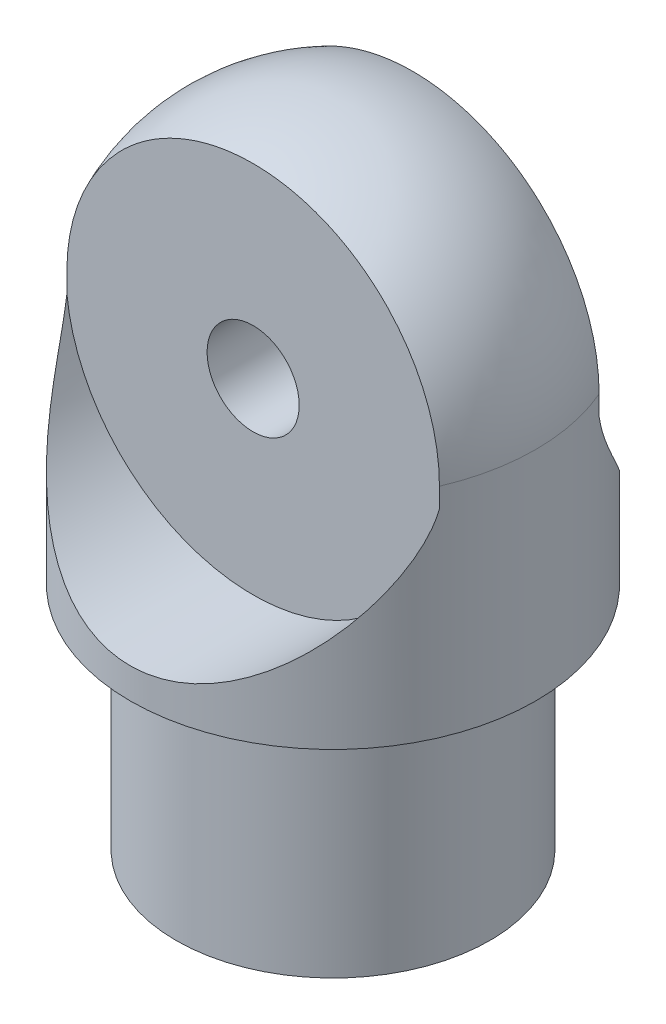
from build123d import *

# Parameters (mm, degrees)
SKETCH1_R               = 12.9794
BOSS_EXTRUDE1_DEPTH     = 19.05
CUT_EXTRUDE1_DEPTH      = 59.815433775
CUT_EXTRUDE1_DEPTH_BACK = 59.815433775
SKETCH4_R               = 3.81
SKETCH5_R               = 15.494
CUT_EXTRUDE2_DEPTH      = 28.194


with BuildPart() as part:
    # Sketch1 → Boss-Extrude1 (new body)
    with BuildSketch(Plane(origin=(0, 0, 0), x_dir=(1, 0, 0), z_dir=(0, 1, 0))):
        Circle(SKETCH1_R)
    extrude(amount=BOSS_EXTRUDE1_DEPTH)

    # Sketch2 → Revolve1 (revolve)
    with BuildSketch(Plane(origin=(0, 0, 0), x_dir=(0, 0, -1), z_dir=(1, 0, 0))):
        with BuildLine():
            Line((0, 19.05), (0, 53.825568814))
            ThreePointArc((0, 53.825568814), (-11.85393808, 48.915506894), (-16.764, 37.061568814))
            Line((-16.764, 37.061568814), (-16.764, 19.05))
            Line((-16.764, 19.05), (0, 19.05))
        make_face()
    revolve(axis=Axis((0, 19.05, 0), (0, 1, 0)))

    # Sketch4 → Cut-Extrude1 (cut, two sides: drawn at the far end of the back side and taken through both)
    with BuildSketch(Plane.XY.offset(-CUT_EXTRUDE1_DEPTH_BACK)):
        with Locations((0, 37.061568814)):
            Circle(SKETCH4_R)
    extrude(amount=CUT_EXTRUDE1_DEPTH + CUT_EXTRUDE1_DEPTH_BACK, mode=Mode.SUBTRACT)

    # Sketch5 → Cut-Extrude2 (cut)
    with BuildSketch(Plane.XY.offset(-6.604)):
        with Locations((0, 37.061568814)):
            Circle(SKETCH5_R)
    cut_extrude2 = extrude(amount=-CUT_EXTRUDE2_DEPTH, mode=Mode.SUBTRACT)

    # Mirror1: Cut-Extrude2 across plane
    add(cut_extrude2.mirror(Plane.XY), mode=Mode.SUBTRACT)


solid = part.part
